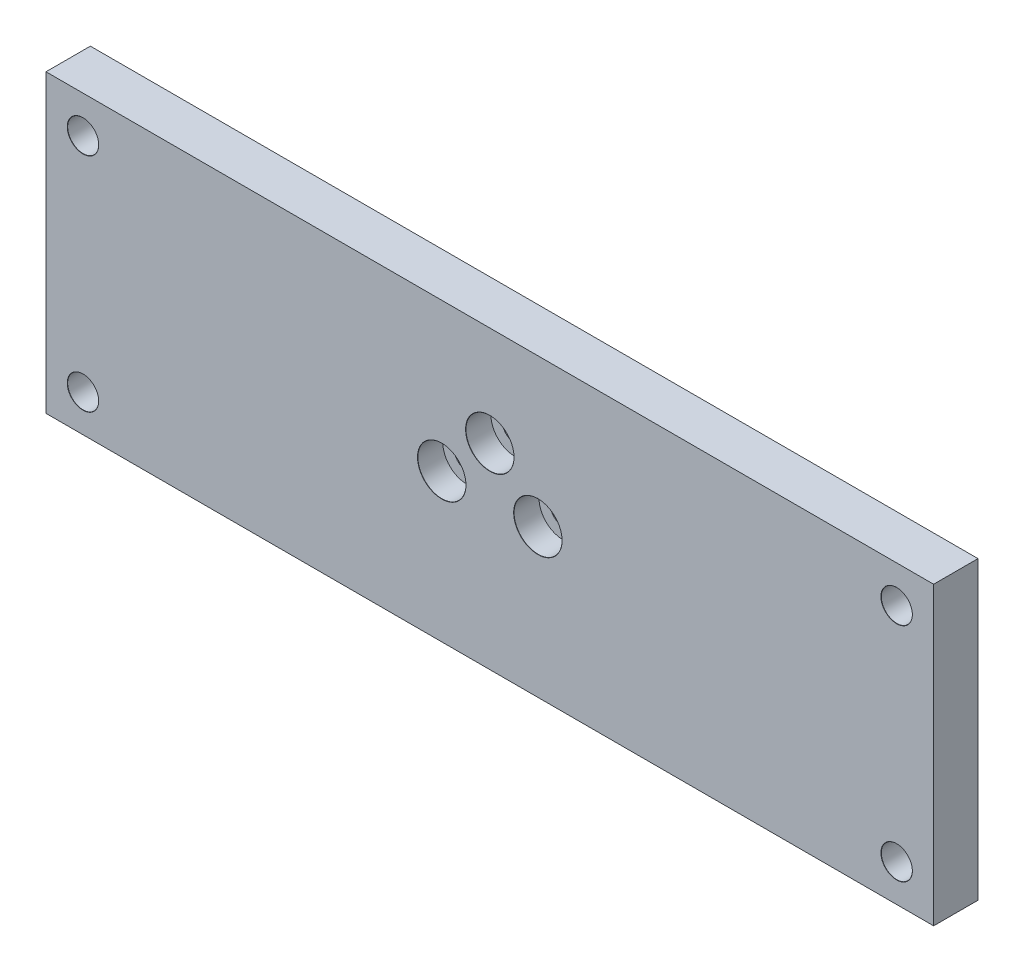
from build123d import *

# Parameters (mm, degrees)
SKETCH1_R                                    = 10
BOSS_EXTRUDE1_DEPTH                          = 6
CBORE_FOR_M3_HEX_SOCKET_HEAD_CAP_SCR_2_COUNT = 2
CBORE_FOR_M3_HEX_SOCKET_HEAD_CAP_SCR_2_PITCH = 9.192388155
CBORE_FOR_M3_HEX_SOCKET_HEAD_CAP_SCR_3_COUNT = 2
CBORE_FOR_M3_HEX_SOCKET_HEAD_CAP_SCR_3_PITCH = 13
BOSS_EXTRUDE2_START                          = -6
SKETCH6_W                                    = 120
SKETCH6_H                                    = 40
SKETCH6_R                                    = 10
BOSS_EXTRUDE2_DEPTH                          = 6


# Read off the part's stored shape, not the designer's step: Tap Drill for M4 Helicoil1
with BuildPart() as part:
    # Sketch1 → Boss-Extrude1 (new body)
    with BuildSketch(Plane.XY):
        Circle(SKETCH1_R)
    extrude(amount=BOSS_EXTRUDE1_DEPTH)

    # Sketch5 → CBORE for M3 Hex Socket Head Cap Screw1 (revolve, cut)
    with BuildSketch(Plane(origin=(-6.5, 0, 6), x_dir=(0, -1, 0), z_dir=(1, 0, 0))):
        Polygon((0, 0), (0, 6), (1.7, 6), (1.7, 3.4), (3.25, 3.4), (3.25, 0.025), (3.275, 0), align=None)
    cbore_for_m3_hex_socket_head_cap_screw1 = revolve(axis=Axis((-6.5, 0, 12.35), (0, 0, -1)), mode=Mode.SUBTRACT)

    # CBORE for M3 Hex Socket Head Cap Scr 2: CBORE for M3 Hex Socket Head Cap Screw1 ×2
    with Locations(*[Vector(0.7071067811865476, 0.7071067811865476, 0) * (i * CBORE_FOR_M3_HEX_SOCKET_HEAD_CAP_SCR_2_PITCH) for i in range(1, CBORE_FOR_M3_HEX_SOCKET_HEAD_CAP_SCR_2_COUNT)]):
        add(cbore_for_m3_hex_socket_head_cap_screw1, mode=Mode.SUBTRACT)

    # CBORE for M3 Hex Socket Head Cap Scr 3: CBORE for M3 Hex Socket Head Cap Screw1 ×2
    with Locations(*[(i * CBORE_FOR_M3_HEX_SOCKET_HEAD_CAP_SCR_3_PITCH, 0, 0) for i in range(1, CBORE_FOR_M3_HEX_SOCKET_HEAD_CAP_SCR_3_COUNT)]):
        add(cbore_for_m3_hex_socket_head_cap_screw1, mode=Mode.SUBTRACT)

    # Sketch6 → Boss-Extrude2 (add)
    with BuildSketch(Plane.XY.offset(6).offset(BOSS_EXTRUDE2_START)):
        Rectangle(SKETCH6_W, SKETCH6_H)
        Circle(SKETCH6_R, mode=Mode.SUBTRACT)
    extrude(amount=BOSS_EXTRUDE2_DEPTH)

    # Tap Drill for M4 Helicoil1 outline → Tap Drill for M4 Helicoil1 (revolve, cut)
    with BuildSketch(Plane(origin=(55, -15, 0), x_dir=(1, 0, 0), z_dir=(0, -1, 0))):
        Polygon((0, 0), (2.1, 0), (2.1, 5.975), (2.125, 6), (0, 6), align=None)
    revolve(axis=Axis((55, -15, 0), (0, 0, 1)), mode=Mode.SUBTRACT)

    # Tap Drill for M4 Helicoil1 2 outline → Tap Drill for M4 Helicoil1 2 (revolve, cut)
    with BuildSketch(Plane(origin=(-55, -15, 0), x_dir=(1, 0, 0), z_dir=(0, -1, 0))):
        Polygon((0, 0), (2.1, 0), (2.1, 5.975), (2.125, 6), (0, 6), align=None)
    revolve(axis=Axis((-55, -15, 0), (0, 0, 1)), mode=Mode.SUBTRACT)

    # Tap Drill for M4 Helicoil1 3 outline → Tap Drill for M4 Helicoil1 3 (revolve, cut)
    with BuildSketch(Plane(origin=(-55, 15, 0), x_dir=(1, 0, 0), z_dir=(0, -1, 0))):
        Polygon((0, 0), (2.1, 0), (2.1, 5.975), (2.125, 6), (0, 6), align=None)
    revolve(axis=Axis((-55, 15, 0), (0, 0, 1)), mode=Mode.SUBTRACT)

    # Tap Drill for M4 Helicoil1 4 outline → Tap Drill for M4 Helicoil1 4 (revolve, cut)
    with BuildSketch(Plane(origin=(55, 15, 0), x_dir=(1, 0, 0), z_dir=(0, -1, 0))):
        Polygon((0, 0), (2.1, 0), (2.1, 5.975), (2.125, 6), (0, 6), align=None)
    revolve(axis=Axis((55, 15, 0), (0, 0, 1)), mode=Mode.SUBTRACT)


solid = part.part
